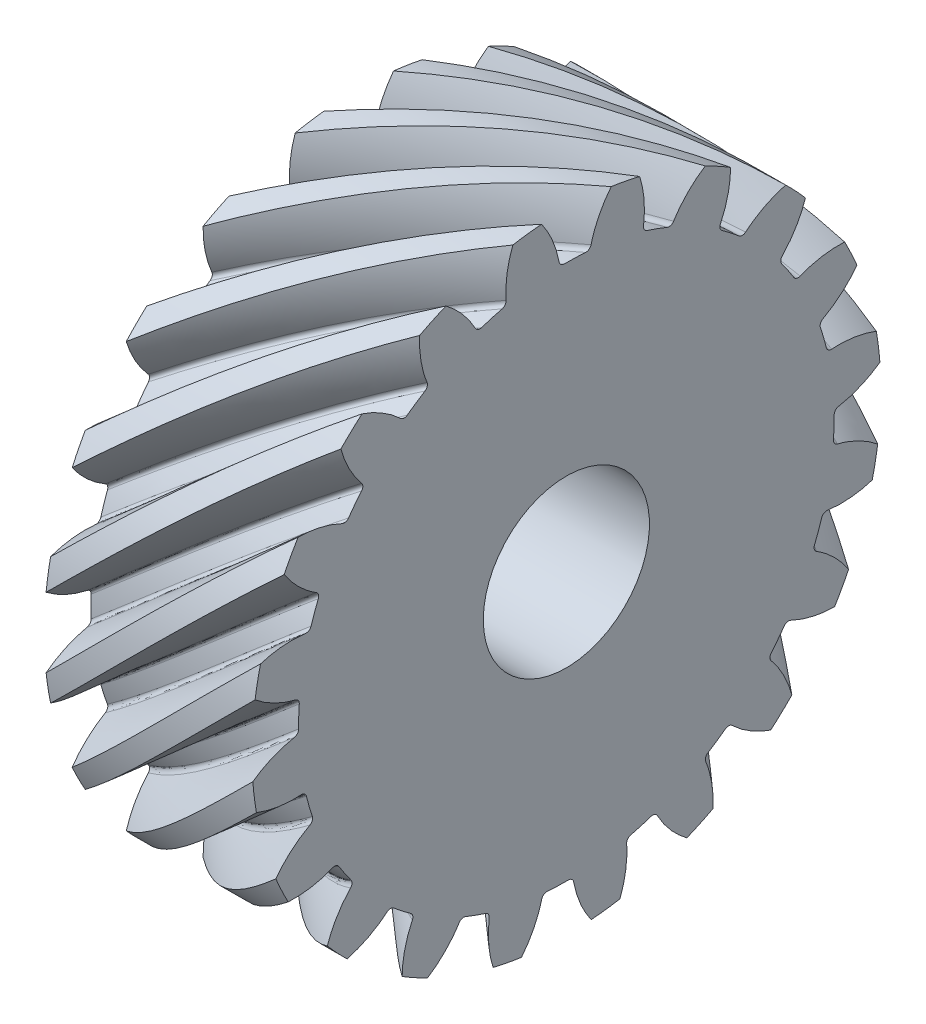
from build123d import *

# Parameters (mm, degrees)
BASPROSKE_W            = 25
BASPROSKE_H            = 37.855339059
TOOTHCUTLH_PITCH       = 237.852110176
TOOTHCUTLH_HEIGHT      = 25
TOOTHCUTLH_RADIUS      = 37.855339059
TOOTHCUTLH_START_ANGLE = -90
TEETHCUTSLH_COUNT      = 20
TEETHCUTSLH_ANGLE      = 342
BORSKE_R               = 10
BORE_DEPTH             = 62.5000025


with BuildPart() as part:
    # BasProSke → Base-Revolve (revolve)
    with BuildSketch(Plane(origin=(0, 0, 0), x_dir=(1, 0, 0), z_dir=(0, 1, 0)), mode=Mode.PRIVATE) as base_revolve_sk:
        with Locations((12.5, 18.92766953)):
            Rectangle(BASPROSKE_W, BASPROSKE_H)
    revolve(base_revolve_sk.sketch.rotate(Axis((-10, 0, 0), (1, 0, 0)), 180), axis=Axis((-10, 0, 0), (1, 0, 0)))

    # ToothCutLH: sweep along a helix
    with BuildLine() as toothcutlh_path:
        add(Helix(TOOTHCUTLH_PITCH, TOOTHCUTLH_HEIGHT, TOOTHCUTLH_RADIUS, center=(0, 0, 0), direction=(1, 0, 0), lefthand=True, mode=Mode.PRIVATE).rotate(Axis((0, 0, 0), (1, 0, 0)), TOOTHCUTLH_START_ANGLE))
    # TooCutSkeRH<3> → ToothCutLH (sweep, cut)
    with BuildSketch(Plane(origin=(0, 0, 0), x_dir=(0, 0, -1), z_dir=(1, 0, 0))):
        with BuildLine():
            ThreePointArc((1.285207939, 32.20470457), (0, 32.230339059), (-1.285207939, 32.20470457))
            ThreePointArc((-1.285207939, 32.20470457), (-1.693249554, 32.335104506), (-1.921908205, 32.697343824))
            ThreePointArc((-1.921908205, 32.697343824), (-3.090909111, 35.895067435), (-5.079415491, 38.658731993))
            ThreePointArc((-5.079415491, 38.658731993), (0, 38.990999231), (5.079415491, 38.658731993))
            ThreePointArc((5.079415491, 38.658731993), (3.090909111, 35.895067435), (1.921908205, 32.697343824))
            ThreePointArc((1.921908205, 32.697343824), (1.693249554, 32.335104506), (1.285207939, 32.20470457))
        make_face()
    toothcutlh = sweep(path=toothcutlh_path.line, is_frenet=True, mode=Mode.SUBTRACT)

    # TeethCutsLH: ToothCutLH ×20 about axis
    teethcutslh_axis = Axis((-10, 0, 0), (1, 0, 0))
    for i in range(1, TEETHCUTSLH_COUNT):
        add(toothcutlh.rotate(teethcutslh_axis, i * TEETHCUTSLH_ANGLE / (TEETHCUTSLH_COUNT - 1)), mode=Mode.SUBTRACT)

    # BorSke → Bore (cut, symmetric)
    with BuildSketch(Plane(origin=(0, 0, 0), x_dir=(0, 0, -1), z_dir=(1, 0, 0))):
        with Locations(Location((0, 0, 0), (0, 0, 180))):
            Circle(BORSKE_R)
    extrude(amount=BORE_DEPTH, both=True, mode=Mode.SUBTRACT)


solid = part.part
